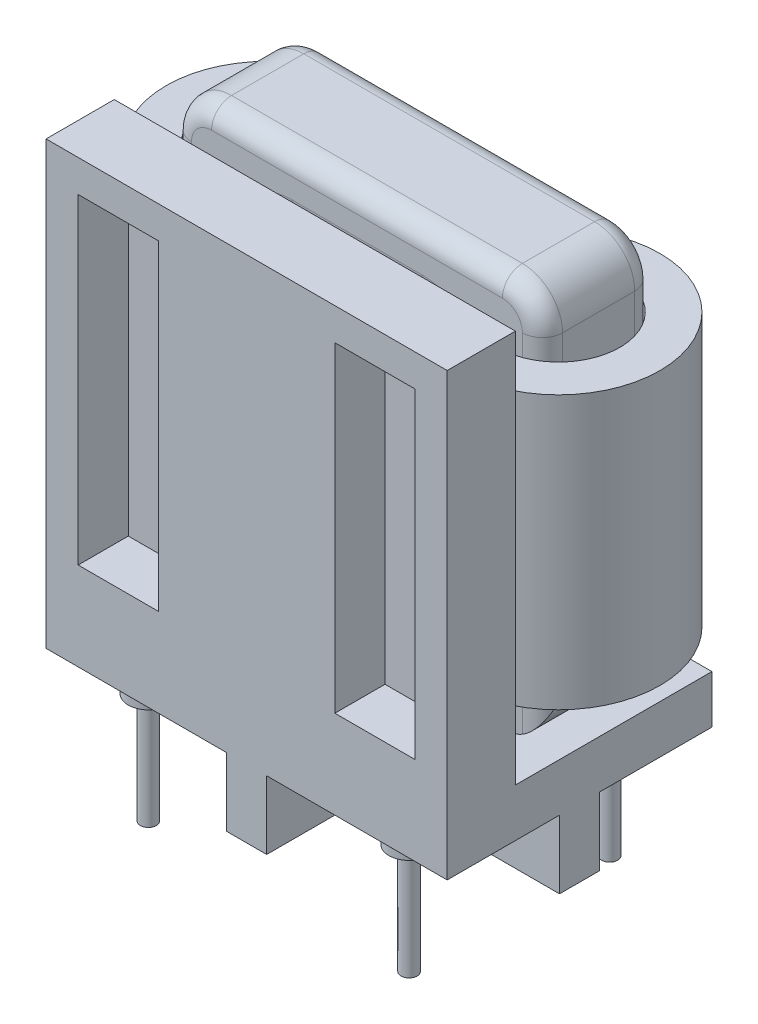
from build123d import *

# Parameters (mm, degrees)
SKETCH1_W                = 9
SKETCH1_H                = 2
SKETCH1_W_2              = 2
SKETCH1_H_2              = 5.6
BOSS_EXTRUDE1_DEPTH      = 3.4
SKETCH2_W                = 20
SKETCH2_H                = 13.2
BOSS_EXTRUDE2_DEPTH      = 2.4
SKETCH3_R                = 0.4
BOSS_EXTRUDE3_DEPTH      = 6.5
SKETCH4_R                = 1
BOSS_EXTRUDE4_DEPTH      = 1
SKETCH5_W                = 20
SKETCH5_H                = 19.6
SKETCH5_W_2              = 4
SKETCH5_H_2              = 16
BOSS_EXTRUDE5_DEPTH      = 3.4
BOSS_EXTRUDE6_START      = -2.5
SKETCH5_2_W              = 4
SKETCH5_2_H              = 16
BOSS_EXTRUDE6_DEPTH      = 0.9
BOSS_EXTRUDE7_DEPTH      = 2.8
BOSS_EXTRUDE7_DEPTH_BACK = 2.8
FILLET1_R                = 1
FILLET2_R                = 1
FILLET3_R                = 1
SKETCH7_R                = 5.059126028
SKETCH7_R_2              = 3.059126028
BOSS_EXTRUDE10_DEPTH     = 13.6
BOSS_EXTRUDE10_2_DEPTH   = 13.6


with BuildPart() as part:
    # Sketch1 → Boss-Extrude1 (new body)
    with BuildSketch(Plane(origin=(0, 0, 0), x_dir=(1, 0, 0), z_dir=(0, 1, 0))):
        with Locations((-5.5, 0)):
            Rectangle(SKETCH1_W, SKETCH1_H)
        Rectangle(SKETCH1_W_2, SKETCH1_H)
        with Locations((0, 3.8)):
            Rectangle(SKETCH1_W_2, SKETCH1_H_2)
        with Locations((0, -3.8)):
            Rectangle(SKETCH1_W_2, SKETCH1_H_2)
        with Locations((5.5, 0)):
            Rectangle(SKETCH1_W, SKETCH1_H)
    extrude(amount=BOSS_EXTRUDE1_DEPTH)

    # Sketch2 → Boss-Extrude2 (add)
    with BuildSketch(Plane(origin=(0, 3.4, 0), x_dir=(1, 0, 0), z_dir=(0, 1, 0))):
        Rectangle(SKETCH2_W, SKETCH2_H)
    extrude(amount=BOSS_EXTRUDE2_DEPTH)

    # Sketch3 → Boss-Extrude3 (add)
    with BuildSketch(Plane.XZ.offset(-3.4)):
        with Locations(Location((6.5, 5, 0), (0, 0, 90))):
            Circle(SKETCH3_R)
        with Locations(Location((-6.5, 5, 0), (0, 0, 90))):
            Circle(SKETCH3_R)
        with Locations(Location((-6.5, -5, 0), (0, 0, 90))):
            Circle(SKETCH3_R)
        with Locations(Location((6.5, -5, 0), (0, 0, 90))):
            Circle(SKETCH3_R)
    extrude(amount=BOSS_EXTRUDE3_DEPTH)

    # Sketch4 → Boss-Extrude4 (add)
    with BuildSketch(Plane.XZ.offset(-3.4)):
        with Locations(Location((6.5, 5, 0), (0, 0, 90))):
            Circle(SKETCH4_R)
        with Locations(Location((-6.5, 5, 0), (0, 0, 90))):
            Circle(SKETCH4_R)
        with Locations(Location((-6.5, -5, 0), (0, 0, 90))):
            Circle(SKETCH4_R)
        with Locations(Location((6.5, -5, 0), (0, 0, 90))):
            Circle(SKETCH4_R)
    extrude(amount=BOSS_EXTRUDE4_DEPTH)

    # Sketch5 → Boss-Extrude5 (add)
    with BuildSketch(Plane.XY.offset(6.6)):
        with Locations((0, 15.6)):
            Rectangle(SKETCH5_W, SKETCH5_H)
        with Locations((-6.4, 15.8)):
            Rectangle(SKETCH5_W_2, SKETCH5_H_2, mode=Mode.SUBTRACT)
        with Locations((6.4, 15.8)):
            Rectangle(SKETCH5_W_2, SKETCH5_H_2, mode=Mode.SUBTRACT)
    extrude(amount=-BOSS_EXTRUDE5_DEPTH)

    # Sketch5<2> → Boss-Extrude6 (add)
    with BuildSketch(Plane.XY.offset(6.6).offset(BOSS_EXTRUDE6_START)):
        with Locations((-6.4, 15.8)):
            Rectangle(SKETCH5_2_W, SKETCH5_2_H)
        with Locations((6.4, 15.8)):
            Rectangle(SKETCH5_2_W, SKETCH5_2_H)
    extrude(amount=-BOSS_EXTRUDE6_DEPTH)

    # Sketch6 → Boss-Extrude7 (add, two sides: drawn at the far end of the back side and taken through both)
    with BuildSketch(Plane(origin=(0, 0, -1.7), x_dir=(-1, 0, 0), z_dir=(0, 0, -1)).offset(-BOSS_EXTRUDE7_DEPTH_BACK)):
        with BuildLine():
            Line((-7.25, 25.4), (7.25, 25.4))
            ThreePointArc((7.25, 25.4), (8.664213562, 24.814213562), (9.25, 23.4))
            Line((9.25, 23.4), (9.25, 7.8))
            ThreePointArc((9.25, 7.8), (8.664213562, 6.385786438), (7.25, 5.8))
            Line((7.25, 5.8), (-7.25, 5.8))
            ThreePointArc((-7.25, 5.8), (-8.664213562, 6.385786438), (-9.25, 7.8))
            Line((-9.25, 7.8), (-9.25, 23.4))
            ThreePointArc((-9.25, 23.4), (-8.664213562, 24.814213562), (-7.25, 25.4))
        make_face()
        with BuildLine():
            Line((-3.25, 22.4), (3.25, 22.4))
            ThreePointArc((3.25, 22.4), (4.664213562, 21.814213562), (5.25, 20.4))
            Line((5.25, 20.4), (5.25, 10.8))
            ThreePointArc((5.25, 10.8), (4.664213562, 9.385786438), (3.25, 8.8))
            Line((3.25, 8.8), (-3.25, 8.8))
            ThreePointArc((-3.25, 8.8), (-4.664213562, 9.385786438), (-5.25, 10.8))
            Line((-5.25, 10.8), (-5.25, 20.4))
            ThreePointArc((-5.25, 20.4), (-4.664213562, 21.814213562), (-3.25, 22.4))
        make_face(mode=Mode.SUBTRACT)
    extrude(amount=BOSS_EXTRUDE7_DEPTH + BOSS_EXTRUDE7_DEPTH_BACK)

    # Fillet1
    fillet1_edges = [part.edges().sort_by_distance(p)[0] for p in [
        (4.664213562, 9.385786438, -4.5),
        (5.25, 15.6, -4.5),
        (4.664213562, 21.814213562, -4.5),
        (0, 22.4, -4.5),
        (-4.664213562, 21.814213562, -4.5),
        (-5.25, 15.6, -4.5),
        (-4.664213562, 9.385786438, -4.5),
        (0, 8.8, -4.5),
    ]]
    fillet(fillet1_edges, radius=FILLET1_R)

    # Fillet2
    fillet2_edges = [part.edges().sort_by_distance(p)[0] for p in [
        (4.664213562, 9.385786438, 1.1),
        (0, 8.8, 1.1),
        (-4.664213562, 9.385786438, 1.1),
        (-5.25, 15.6, 1.1),
        (-4.664213562, 21.814213562, 1.1),
        (0, 22.4, 1.1),
        (4.664213562, 21.814213562, 1.1),
        (5.25, 15.6, 1.1),
    ]]
    fillet(fillet2_edges, radius=FILLET2_R)

    # Fillet3
    # the kernel refuses this fillet: 1 mm, written as the material it takes off along each edge
    with BuildSketch(Plane(origin=(-7.25, 23.4, 1.1), x_dir=(0, 1, 0), z_dir=(1, 0, 0))) as fillet3_piece_1:
        with BuildLine():
            CenterArc((2 - FILLET3_R, -FILLET3_R), FILLET3_R, 0, 90)
            Line((2, -FILLET3_R), (2, 0))
            Line((2, 0), (2 - FILLET3_R, 0))
        make_face()
    revolve(axis=Axis((-7.25, 23.4, 1.1), (0, 0, 1)), revolution_arc=90, mode=Mode.SUBTRACT)
    with BuildSketch(Plane(origin=(-9.25, 23.4, 1.1), x_dir=(1, 0, 0), z_dir=(0, -1, 0))) as fillet3_piece_2_section:
        with BuildLine():
            CenterArc((FILLET3_R, -FILLET3_R), FILLET3_R, 90, 90)
            Line((0, -FILLET3_R), (0, 0))
            Line((0, 0), (FILLET3_R, 0))
        make_face()
    fillet3_piece_2 = extrude(amount=18.1, mode=Mode.PRIVATE)
    fillet3_piece_2 = split(fillet3_piece_2, bisect_by=Plane(origin=(-8.945227871, 5.8, 0.930013711), z_dir=(0, 1, 0)), keep=Keep.TOP, mode=Mode.PRIVATE)
    add(fillet3_piece_2, mode=Mode.SUBTRACT)
    with BuildSketch(Plane(origin=(9.25, 5.3, 1.1), x_dir=(-1, 0, 0), z_dir=(0, 1, 0))) as fillet3_piece_3_section:
        with BuildLine():
            CenterArc((FILLET3_R, -FILLET3_R), FILLET3_R, 90, 90)
            Line((0, -FILLET3_R), (0, 0))
            Line((0, 0), (FILLET3_R, 0))
        make_face()
    fillet3_piece_3 = extrude(amount=18.1, mode=Mode.PRIVATE)
    fillet3_piece_3 = split(fillet3_piece_3, bisect_by=Plane(origin=(8.945226786, 5.8, 0.930013735), z_dir=(0, 1, 0)), keep=Keep.TOP, mode=Mode.PRIVATE)
    add(fillet3_piece_3, mode=Mode.SUBTRACT)
    with BuildSketch(Plane(origin=(7.25, 23.4, 1.1), x_dir=(1, 0, 0), z_dir=(0, -1, 0))) as fillet3_piece_4:
        with BuildLine():
            CenterArc((2 - FILLET3_R, -FILLET3_R), FILLET3_R, 0, 90)
            Line((2, -FILLET3_R), (2, 0))
            Line((2, 0), (2 - FILLET3_R, 0))
        make_face()
    revolve(axis=Axis((7.25, 23.4, 1.1), (0, 0, 1)), revolution_arc=90, mode=Mode.SUBTRACT)
    with BuildSketch(Plane(origin=(7.25, 25.4, 1.1), x_dir=(0, -1, 0), z_dir=(-1, 0, 0))) as fillet3_piece_5:
        with BuildLine():
            CenterArc((FILLET3_R, -FILLET3_R), FILLET3_R, 90, 90)
            Line((0, -FILLET3_R), (0, 0))
            Line((0, 0), (FILLET3_R, 0))
        make_face()
    extrude(amount=14.5, mode=Mode.SUBTRACT)
    with BuildSketch(Plane(origin=(-7.25, 23.4, -4.5), x_dir=(0, 1, 0), z_dir=(1, 0, 0))) as fillet3_piece_6:
        with BuildLine():
            CenterArc((2 - FILLET3_R, FILLET3_R), FILLET3_R, 270, 90)
            Line((2, FILLET3_R), (2, 0))
            Line((2, 0), (2 - FILLET3_R, 0))
        make_face()
    revolve(axis=Axis((-7.25, 23.4, -4.5), (0, 0, 1)), revolution_arc=90, mode=Mode.SUBTRACT)
    with BuildSketch(Plane(origin=(7.25, 25.4, -4.5), x_dir=(0, -1, 0), z_dir=(-1, 0, 0))) as fillet3_piece_7:
        with BuildLine():
            CenterArc((FILLET3_R, FILLET3_R), FILLET3_R, 180, 90)
            Line((0, FILLET3_R), (0, 0))
            Line((0, 0), (FILLET3_R, 0))
        make_face()
    extrude(amount=14.5, mode=Mode.SUBTRACT)
    with BuildSketch(Plane(origin=(7.25, 23.4, -4.5), x_dir=(1, 0, 0), z_dir=(0, -1, 0))) as fillet3_piece_8:
        with BuildLine():
            CenterArc((2 - FILLET3_R, FILLET3_R), FILLET3_R, 270, 90)
            Line((2, FILLET3_R), (2, 0))
            Line((2, 0), (2 - FILLET3_R, 0))
        make_face()
    revolve(axis=Axis((7.25, 23.4, -4.5), (0, 0, 1)), revolution_arc=90, mode=Mode.SUBTRACT)
    with BuildSketch(Plane(origin=(9.25, 5.3, -4.5), x_dir=(-1, 0, 0), z_dir=(0, 1, 0))) as fillet3_piece_9_section:
        with BuildLine():
            CenterArc((FILLET3_R, FILLET3_R), FILLET3_R, 180, 90)
            Line((0, FILLET3_R), (0, 0))
            Line((0, 0), (FILLET3_R, 0))
        make_face()
    fillet3_piece_9 = extrude(amount=18.1, mode=Mode.PRIVATE)
    fillet3_piece_9 = split(fillet3_piece_9, bisect_by=Plane(origin=(8.945226723, 5.8, -4.330013641), z_dir=(0, 1, 0)), keep=Keep.TOP, mode=Mode.PRIVATE)
    add(fillet3_piece_9, mode=Mode.SUBTRACT)
    with BuildSketch(Plane(origin=(-9.25, 23.4, -4.5), x_dir=(1, 0, 0), z_dir=(0, -1, 0))) as fillet3_piece_10_section:
        with BuildLine():
            CenterArc((FILLET3_R, FILLET3_R), FILLET3_R, 180, 90)
            Line((0, FILLET3_R), (0, 0))
            Line((0, 0), (FILLET3_R, 0))
        make_face()
    fillet3_piece_10 = extrude(amount=18.1, mode=Mode.PRIVATE)
    fillet3_piece_10 = split(fillet3_piece_10, bisect_by=Plane(origin=(-8.945227871, 5.8, -4.330013708), z_dir=(0, 1, 0)), keep=Keep.TOP, mode=Mode.PRIVATE)
    add(fillet3_piece_10, mode=Mode.SUBTRACT)


with BuildPart() as body_2:
    # Sketch7 → Boss-Extrude10 (new body)
    with BuildSketch(Plane(origin=(0, 8.8, 0), x_dir=(1, 0, 0), z_dir=(0, 1, 0))):
        with Locations(Location((-7.25, 1.7, 0), (0, 0, 270))):
            Circle(SKETCH7_R)
        with Locations(Location((-7.25, 1.7, 0), (0, 0, 270))):
            Circle(SKETCH7_R_2, mode=Mode.SUBTRACT)
    extrude(amount=BOSS_EXTRUDE10_DEPTH)


with BuildPart() as body_3:
    # Sketch7 → Boss-Extrude10 2 (new body)
    with BuildSketch(Plane(origin=(0, 8.8, 0), x_dir=(1, 0, 0), z_dir=(0, 1, 0))):
        with Locations(Location((7.25, 1.7, 0), (0, 0, 270))):
            Circle(SKETCH7_R)
        with Locations(Location((7.25, 1.7, 0), (0, 0, 270))):
            Circle(SKETCH7_R_2, mode=Mode.SUBTRACT)
    extrude(amount=BOSS_EXTRUDE10_2_DEPTH)


solid = Compound([part.part, body_2.part, body_3.part])
